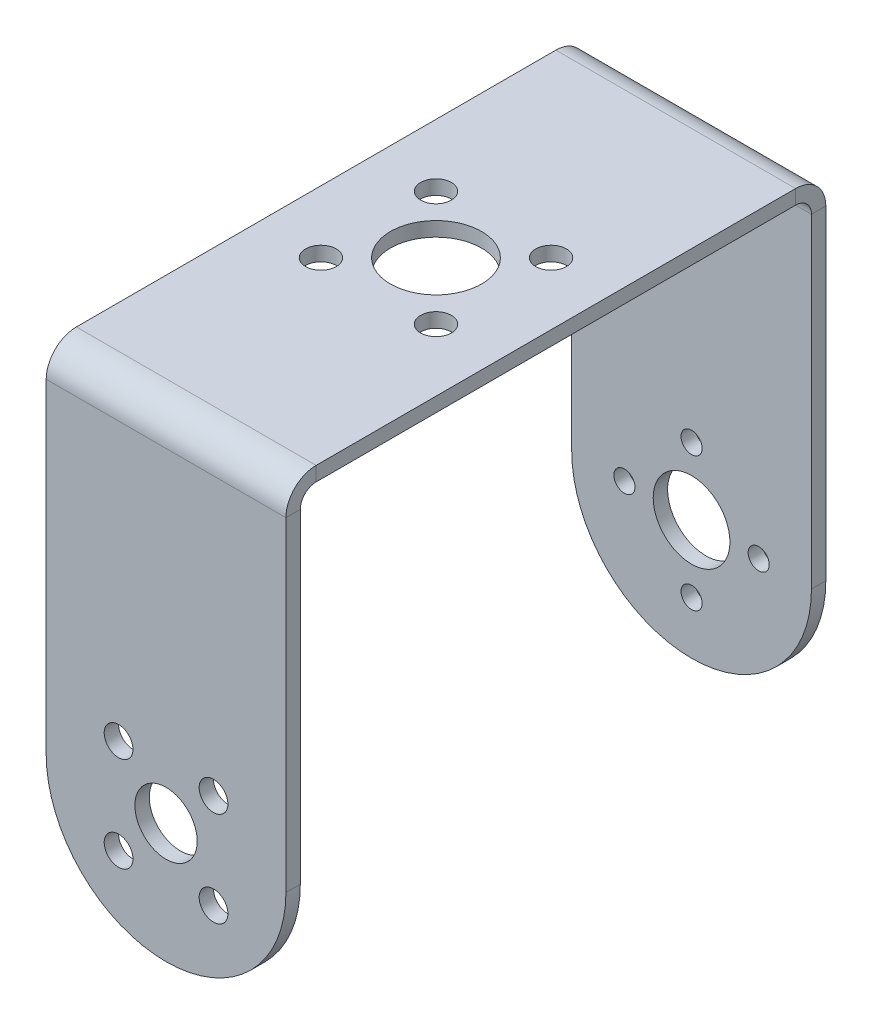
from build123d import *

# Parameters (mm, degrees)
SKETCH1_W                      = 25
SKETCH1_H                      = 53.3
BASE_FLANGE1_DEPTH             = 1.5
EDGE_FLANGE1_STRIP_W           = 9.3
EDGE_FLANGE1_STRIP_H           = 1.5
EDGE_FLANGE1_STRIP_CUT_DEPTH   = 25
EDGE_FLANGE1_STRIP_2_W         = 9.3
EDGE_FLANGE1_STRIP_2_H         = 1.5
EDGE_FLANGE1_STRIP_CUT_2_DEPTH = 25
EDGE_FLANGE1_DEPTH             = 25
EDGE_FLANGE1_BEND_DEPTH        = 25
CUT_EXTRUDE1_REACH             = 78.001
SKETCH12_R                     = 1.5
SKETCH12_R_2                   = 3.25
CUT_EXTRUDE2_REACH             = 78.001
SKETCH13_R                     = 4
SKETCH13_R_2                   = 1.1
FILLET1_R                      = 12.5
SKETCH17_R                     = 1.6
CUT_EXTRUDE3_DEPTH             = 59.30027873
SKETCH18_R                     = 4.75
CUT_EXTRUDE4_DEPTH             = 59.30027873


# Sheet-metal steps are written as plain solids
with BuildPart() as part:
    # Sketch1 → Base-Flange1 (new body)
    with BuildSketch(Plane(origin=(0, 0, 0), x_dir=(1, 0, 0), z_dir=(0, 1, 0))):
        Rectangle(SKETCH1_W, SKETCH1_H)
    extrude(amount=-BASE_FLANGE1_DEPTH)

    # Edge-Flange1 strip (across the edge) → Edge-Flange1 strip cut (cut)
    with BuildSketch(Plane(origin=(12.5, -1.5, 26.65), x_dir=(0, 0, -1), z_dir=(-1, 0, 0))):
        with Locations((-3, -0.75)):
            Rectangle(EDGE_FLANGE1_STRIP_W, EDGE_FLANGE1_STRIP_H)
    extrude(amount=EDGE_FLANGE1_STRIP_CUT_DEPTH, mode=Mode.SUBTRACT)

    # Edge-Flange1 strip 2 (across the edge) → Edge-Flange1 strip cut 2 (cut)
    with BuildSketch(Plane(origin=(-12.5, -1.5, -26.65), x_dir=(0, 0, 1), z_dir=(1, 0, 0))):
        with Locations((-3, -0.75)):
            Rectangle(EDGE_FLANGE1_STRIP_2_W, EDGE_FLANGE1_STRIP_2_H)
    extrude(amount=EDGE_FLANGE1_STRIP_CUT_2_DEPTH, mode=Mode.SUBTRACT)

    # Edge-Flange1 section (across the edge) → Edge-Flange1 (add)
    with BuildSketch(Plane(origin=(12.5, -1.5, 26.65), x_dir=(0, 0, -1), z_dir=(-1, 0, 0))):
        with BuildLine():
            Line((-1.5, 1.65), (-1.5, 48))
            Line((-1.5, 48), (0, 48))
            Line((0, 48), (0, 1.65))
            ThreePointArc((0, 1.65), (0.483273811, 0.483273811), (1.65, 0))
            Line((1.65, 0), (1.65, -1.5))
            ThreePointArc((1.65, -1.5), (-0.577386361, -0.577386361), (-1.5, 1.65))
        make_face()
    extrude(amount=EDGE_FLANGE1_DEPTH)

    # Edge-Flange1 section 2 (across the edge) → Edge-Flange1 bend (add)
    with BuildSketch(Plane(origin=(-12.5, -1.5, -26.65), x_dir=(0, 0, 1), z_dir=(1, 0, 0))):
        with BuildLine():
            Line((-1.5, 1.65), (-1.5, 48))
            Line((-1.5, 48), (0, 48))
            Line((0, 48), (0, 1.65))
            ThreePointArc((0, 1.65), (0.483273811, 0.483273811), (1.65, 0))
            Line((1.65, 0), (1.65, -1.5))
            ThreePointArc((1.65, -1.5), (-0.577386361, -0.577386361), (-1.5, 1.65))
        make_face()
    extrude(amount=EDGE_FLANGE1_BEND_DEPTH)

    # Sketch12 → Cut-Extrude1 (cut, up to next)
    with BuildSketch(Plane.XY.offset(28.15), mode=Mode.PRIVATE) as cut_extrude1_sk1:
        with Locations((-4.949747468, -32.050252532)):
            Circle(SKETCH12_R)
    cut_extrude1_tool1 = extrude(cut_extrude1_sk1.sketch, amount=-CUT_EXTRUDE1_REACH, mode=Mode.PRIVATE) & part.part
    # Sketch12 → Cut-Extrude1 (cut, up to next)
    with BuildSketch(Plane.XY.offset(28.15), mode=Mode.PRIVATE) as cut_extrude1_sk2:
        with Locations((4.949747468, -32.050252532)):
            Circle(SKETCH12_R)
    cut_extrude1_tool2 = extrude(cut_extrude1_sk2.sketch, amount=-CUT_EXTRUDE1_REACH, mode=Mode.PRIVATE) & part.part
    # Sketch12 → Cut-Extrude1 (cut, up to next)
    with BuildSketch(Plane.XY.offset(28.15), mode=Mode.PRIVATE) as cut_extrude1_sk3:
        with Locations((-4.949747468, -41.949747468)):
            Circle(SKETCH12_R)
    cut_extrude1_tool3 = extrude(cut_extrude1_sk3.sketch, amount=-CUT_EXTRUDE1_REACH, mode=Mode.PRIVATE) & part.part
    # Sketch12 → Cut-Extrude1 (cut, up to next)
    with BuildSketch(Plane.XY.offset(28.15), mode=Mode.PRIVATE) as cut_extrude1_sk4:
        with Locations((4.949747468, -41.949747468)):
            Circle(SKETCH12_R)
    cut_extrude1_tool4 = extrude(cut_extrude1_sk4.sketch, amount=-CUT_EXTRUDE1_REACH, mode=Mode.PRIVATE) & part.part
    # Sketch12 → Cut-Extrude1 (cut, up to next)
    with BuildSketch(Plane.XY.offset(28.15), mode=Mode.PRIVATE) as cut_extrude1_sk5:
        with Locations((0, -37)):
            Circle(SKETCH12_R_2)
    cut_extrude1_tool5 = extrude(cut_extrude1_sk5.sketch, amount=-CUT_EXTRUDE1_REACH, mode=Mode.PRIVATE) & part.part
    add(cut_extrude1_tool1.solids().sort_by_distance((-4.949747, -32.050253, 28.15))[0], mode=Mode.SUBTRACT)
    add(cut_extrude1_tool2.solids().sort_by_distance((4.949747, -32.050253, 28.15))[0], mode=Mode.SUBTRACT)
    add(cut_extrude1_tool3.solids().sort_by_distance((-4.949747, -41.949747, 28.15))[0], mode=Mode.SUBTRACT)
    add(cut_extrude1_tool4.solids().sort_by_distance((4.949747, -41.949747, 28.15))[0], mode=Mode.SUBTRACT)
    add(cut_extrude1_tool5.solids().sort_by_distance((0, -37, 28.15))[0], mode=Mode.SUBTRACT)

    # Sketch13 → Cut-Extrude2 (cut, up to next)
    with BuildSketch(Plane(origin=(0, 0, -28.15), x_dir=(-1, 0, 0), z_dir=(0, 0, -1)), mode=Mode.PRIVATE) as cut_extrude2_sk1:
        with Locations(Location((0, -37, 0), (0, 0, 90))):
            Circle(SKETCH13_R)
    cut_extrude2_tool1 = extrude(cut_extrude2_sk1.sketch, amount=-CUT_EXTRUDE2_REACH, mode=Mode.PRIVATE) & part.part
    # Sketch13 → Cut-Extrude2 (cut, up to next)
    with BuildSketch(Plane(origin=(0, 0, -28.15), x_dir=(-1, 0, 0), z_dir=(0, 0, -1)), mode=Mode.PRIVATE) as cut_extrude2_sk2:
        with Locations(Location((0, -44, 0), (0, 0, 90))):
            Circle(SKETCH13_R_2)
    cut_extrude2_tool2 = extrude(cut_extrude2_sk2.sketch, amount=-CUT_EXTRUDE2_REACH, mode=Mode.PRIVATE) & part.part
    # Sketch13 → Cut-Extrude2 (cut, up to next)
    with BuildSketch(Plane(origin=(0, 0, -28.15), x_dir=(-1, 0, 0), z_dir=(0, 0, -1)), mode=Mode.PRIVATE) as cut_extrude2_sk3:
        with Locations(Location((-7, -37, 0), (0, 0, 90))):
            Circle(SKETCH13_R_2)
    cut_extrude2_tool3 = extrude(cut_extrude2_sk3.sketch, amount=-CUT_EXTRUDE2_REACH, mode=Mode.PRIVATE) & part.part
    # Sketch13 → Cut-Extrude2 (cut, up to next)
    with BuildSketch(Plane(origin=(0, 0, -28.15), x_dir=(-1, 0, 0), z_dir=(0, 0, -1)), mode=Mode.PRIVATE) as cut_extrude2_sk4:
        with Locations(Location((0, -30, 0), (0, 0, 90))):
            Circle(SKETCH13_R_2)
    cut_extrude2_tool4 = extrude(cut_extrude2_sk4.sketch, amount=-CUT_EXTRUDE2_REACH, mode=Mode.PRIVATE) & part.part
    # Sketch13 → Cut-Extrude2 (cut, up to next)
    with BuildSketch(Plane(origin=(0, 0, -28.15), x_dir=(-1, 0, 0), z_dir=(0, 0, -1)), mode=Mode.PRIVATE) as cut_extrude2_sk5:
        with Locations(Location((7, -37, 0), (0, 0, 90))):
            Circle(SKETCH13_R_2)
    cut_extrude2_tool5 = extrude(cut_extrude2_sk5.sketch, amount=-CUT_EXTRUDE2_REACH, mode=Mode.PRIVATE) & part.part
    add(cut_extrude2_tool1.solids().sort_by_distance((0, -37, -28.15))[0], mode=Mode.SUBTRACT)
    add(cut_extrude2_tool2.solids().sort_by_distance((0, -44, -28.15))[0], mode=Mode.SUBTRACT)
    add(cut_extrude2_tool3.solids().sort_by_distance((7, -37, -28.15))[0], mode=Mode.SUBTRACT)
    add(cut_extrude2_tool4.solids().sort_by_distance((0, -30, -28.15))[0], mode=Mode.SUBTRACT)
    add(cut_extrude2_tool5.solids().sort_by_distance((-7, -37, -28.15))[0], mode=Mode.SUBTRACT)

    # Fillet1
    fillet1_edges = [part.edges().sort_by_distance(p)[0] for p in [
        (12.5, -49.5, 27.4),
        (-12.5, -49.5, 27.4),
        (-12.5, -49.5, -27.4),
        (12.5, -49.5, -27.4),
    ]]
    fillet(fillet1_edges, radius=FILLET1_R - 0.0001)  # a hair under: the kernel refuses the full size

    # Sketch17 → Cut-Extrude3 (cut, through all)
    with BuildSketch(Plane(origin=(0, 0, 0), x_dir=(1, 0, 0), z_dir=(0, 1, 0))):
        with Locations(Location((-6, 6, 0), (0, 0, 270))):
            Circle(SKETCH17_R)
        with Locations(Location((6, 6, 0), (0, 0, 270))):
            Circle(SKETCH17_R)
        with Locations(Location((6, -6, 0), (0, 0, 270))):
            Circle(SKETCH17_R)
        with Locations(Location((-6, -6, 0), (0, 0, 270))):
            Circle(SKETCH17_R)
    extrude(amount=-CUT_EXTRUDE3_DEPTH, mode=Mode.SUBTRACT)

    # Sketch18 → Cut-Extrude4 (cut, through all)
    with BuildSketch(Plane(origin=(0, 0, 0), x_dir=(1, 0, 0), z_dir=(0, 1, 0))):
        with Locations(Location((0, 0, 0), (0, 0, 270))):
            Circle(SKETCH18_R)
    extrude(amount=-CUT_EXTRUDE4_DEPTH, mode=Mode.SUBTRACT)


solid = part.part
